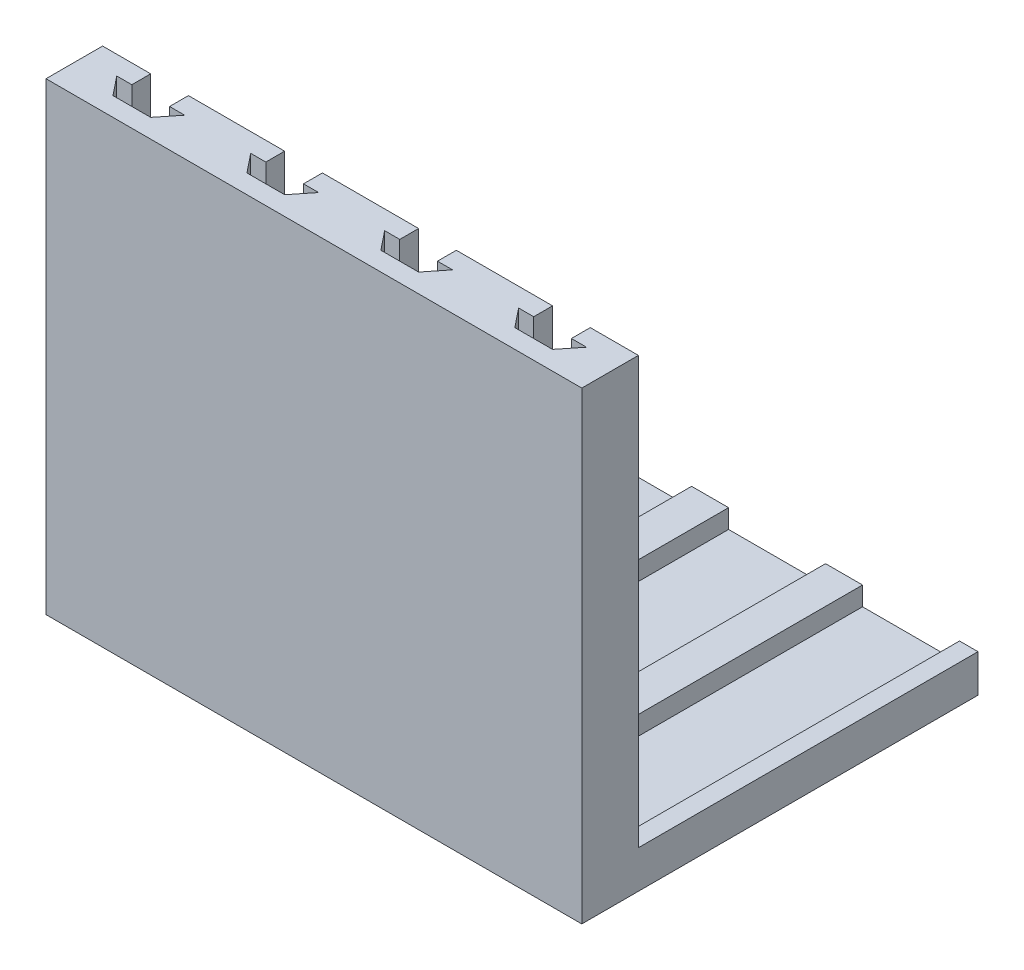
from build123d import *

# Parameters (mm, degrees)
SKETCH1_W           = 35.5
SKETCH1_H           = 105
BOSS_EXTRUDE1_DEPTH = 10
SKETCH2_W           = 35.5
SKETCH2_H           = 15
BOSS_EXTRUDE2_DEPTH = 113
SKETCH5_W           = 25.7
SKETCH5_H           = 90
CUT_EXTRUDE2_DEPTH  = 5
CUT_EXTRUDE3_DEPTH  = 50
SKETCH7_W           = 10
SKETCH7_H           = 2
CUT_EXTRUDE4_DEPTH  = 68
LPATTERN1_COUNT     = 4
LPATTERN1_PITCH     = 35.5


with BuildPart() as part:
    # Sketch1 → Boss-Extrude1 (new body)
    with BuildSketch(Plane(origin=(0, 0, 0), x_dir=(1, 0, 0), z_dir=(0, 1, 0))):
        Rectangle(SKETCH1_W, SKETCH1_H)
    boss_extrude1 = extrude(amount=BOSS_EXTRUDE1_DEPTH)

    # Sketch2 → Boss-Extrude2 (add)
    with BuildSketch(Plane(origin=(0, 10, 0), x_dir=(1, 0, 0), z_dir=(0, 1, 0))):
        with Locations((0, -45)):
            Rectangle(SKETCH2_W, SKETCH2_H)
    boss_extrude2 = extrude(amount=BOSS_EXTRUDE2_DEPTH)

    # Sketch5 → Cut-Extrude2 (cut)
    with BuildSketch(Plane(origin=(0, 10, 0), x_dir=(1, 0, 0), z_dir=(0, 1, 0))):
        with Locations((0, 7.5)):
            Rectangle(SKETCH5_W, SKETCH5_H)
    cut_extrude2 = extrude(amount=-CUT_EXTRUDE2_DEPTH, mode=Mode.SUBTRACT)

    # Sketch6 → Cut-Extrude3 (cut)
    with BuildSketch(Plane(origin=(0, 123, 0), x_dir=(1, 0, 0), z_dir=(0, 1, 0))):
        Polygon((-5, -37.5), (5, -37.5), (5, -42.5), (9, -42.5), (5, -47.5), (-5, -47.5), (-9, -42.5), (-5, -42.5), align=None)
    cut_extrude3 = extrude(amount=-CUT_EXTRUDE3_DEPTH, mode=Mode.SUBTRACT)

    # Sketch7 → Cut-Extrude4 (cut)
    with BuildSketch(Plane(origin=(0, 73, 0), x_dir=(1, 0, 0), z_dir=(0, 1, 0))):
        with Locations((0, -38.5)):
            Rectangle(SKETCH7_W, SKETCH7_H)
    cut_extrude4 = extrude(amount=-CUT_EXTRUDE4_DEPTH, mode=Mode.SUBTRACT)

    # LPattern1: Boss-Extrude1, Boss-Extrude2, Cut-Extrude2, Cut-Extrude3, Cut-Extrude4 ×4
    with Locations(*[(-i * LPATTERN1_PITCH, 0, 0) for i in range(1, LPATTERN1_COUNT)]):
        add(boss_extrude1)
        add(boss_extrude2)
        add(cut_extrude2, mode=Mode.SUBTRACT)
        add(cut_extrude3, mode=Mode.SUBTRACT)
        add(cut_extrude4, mode=Mode.SUBTRACT)


solid = part.part
